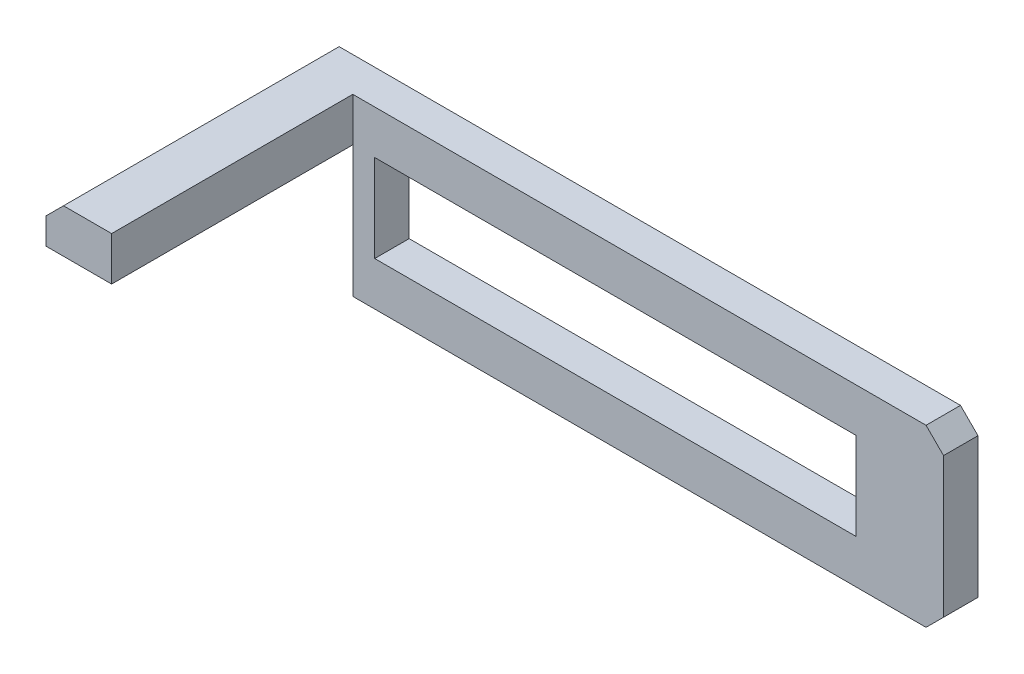
from build123d import *

# Parameters (mm, degrees)
SKETCH1_W           = 95.25
SKETCH1_H           = 25.4
SKETCH1_W_2         = 69.85
SKETCH1_H_2         = 12.7
BOSS_EXTRUDE1_DEPTH = 5
SKETCH2_W           = 9.525
SKETCH2_H           = 6.35
BOSS_EXTRUDE2_DEPTH = 35
CHAMFER1_SIZE       = 2.54
SKETCH4_W           = 9.525
SKETCH4_H           = 19.05
CUT_EXTRUDE2_DEPTH  = 105.607468663


with BuildPart() as part:
    # Sketch1 → Boss-Extrude1 (new body)
    with BuildSketch(Plane.XY):
        with Locations((-47.625, 12.7)):
            Rectangle(SKETCH1_W, SKETCH1_H)
        with Locations((-47.625, 12.7)):
            Rectangle(SKETCH1_W_2, SKETCH1_H_2, mode=Mode.SUBTRACT)
    extrude(amount=BOSS_EXTRUDE1_DEPTH)

    # Sketch2 → Boss-Extrude2 (add)
    with BuildSketch(Plane.XY.offset(5)):
        with Locations((-90.4875, 22.225)):
            Rectangle(SKETCH2_W, SKETCH2_H)
    extrude(amount=BOSS_EXTRUDE2_DEPTH)

    # Chamfer1
    chamfer1_edges = [part.edges().sort_by_distance(p)[0] for p in [
        (0, 0, 2.5),
        (-95.25, 0, 2.5),
        (0, 25.4, 2.5),
        (-95.25, 25.4, 20),
    ]]
    chamfer(chamfer1_edges, length=CHAMFER1_SIZE)

    # Sketch4 → Cut-Extrude2 (cut, through all)
    with BuildSketch(Plane.XY.offset(5)):
        with Locations((-90.4875, 9.525)):
            Rectangle(SKETCH4_W, SKETCH4_H)
    extrude(amount=-CUT_EXTRUDE2_DEPTH, mode=Mode.SUBTRACT)


solid = part.part
